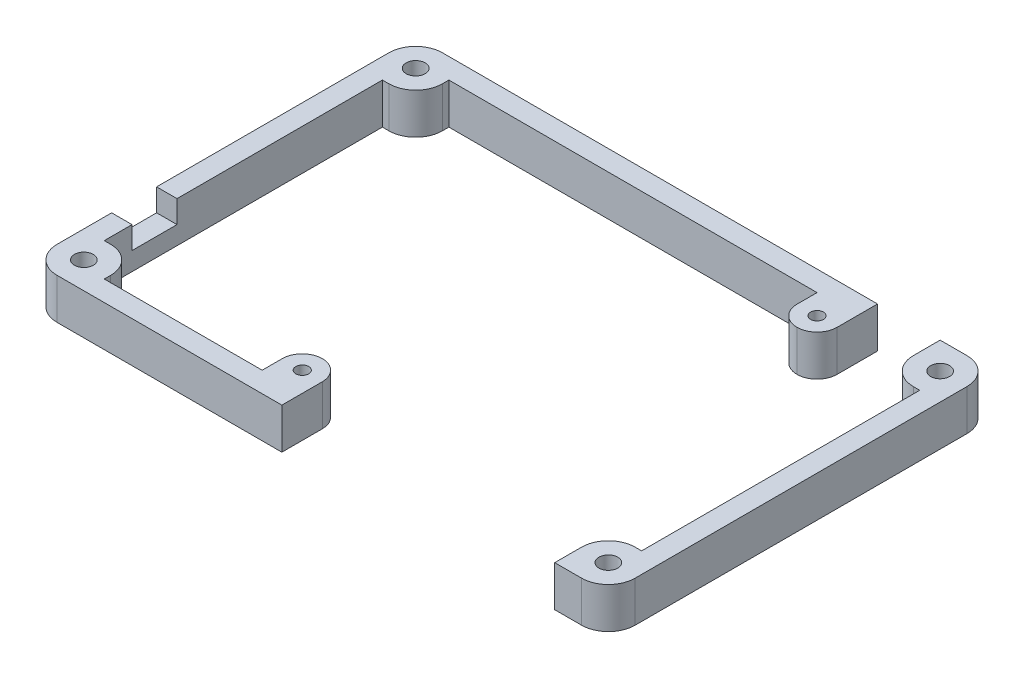
from build123d import *

# Parameters (mm, degrees)
BOSS_EXTRUDE3_DEPTH = 6.35
SKETCH3_W           = 9.747311717
SKETCH3_H           = 6.35
CUT_EXTRUDE1_DEPTH  = 3.175
SKETCH4_W           = 42.475
SKETCH4_H           = 6.35
CUT_EXTRUDE2_DEPTH  = 8.35
SKETCH5_W           = 7
SKETCH5_H           = 7
CUT_EXTRUDE3_DEPTH  = 3.175
SKETCH7_R           = 1.4732
CUT_EXTRUDE4_DEPTH  = 10
SKETCH10_W          = 6.24
SKETCH10_H          = 6.35
BOSS_EXTRUDE4_DEPTH = 6.24
SKETCH11_W          = 6.24
SKETCH11_H          = 6.35
BOSS_EXTRUDE5_DEPTH = 6.24
SKETCH12_R          = 1
CUT_EXTRUDE5_DEPTH  = 55.454774814
SKETCH13_R          = 1
CUT_EXTRUDE6_DEPTH  = 55.454774814
FILLET1_R           = 3.12


with BuildPart() as part:
    # Sketch2 → Boss-Extrude3 (new body)
    with BuildSketch(Plane(origin=(0, 0, 0), x_dir=(1, 0, 0), z_dir=(0, 1, 0))):
        with BuildLine():
            Line((-45, 25.825), (-45, -25.825))
            ThreePointArc((-45, -25.825), (-43.777170811, -28.777170811), (-40.825, -30))
            Line((-40.825, -30), (40.825, -30))
            ThreePointArc((40.825, -30), (43.777170811, -28.777170811), (45, -25.825))
            Line((45, -25.825), (45, 25.825))
            ThreePointArc((45, 25.825), (43.777170811, 28.777170811), (40.825, 30))
            Line((40.825, 30), (-40.825, 30))
            ThreePointArc((-40.825, 30), (-43.777170811, 28.777170811), (-45, 25.825))
        make_face()
        with BuildLine():
            Line((40.825, 21.65), (41.825, 21.65))
            Line((41.825, 21.65), (41.825, -21.65))
            Line((41.825, -21.65), (40.825, -21.65))
            ThreePointArc((40.825, -21.65), (37.872829189, -22.872829189), (36.65, -25.825))
            Line((36.65, -25.825), (36.65, -26.825))
            Line((36.65, -26.825), (-36.65, -26.825))
            Line((-36.65, -26.825), (-36.65, -25.825))
            ThreePointArc((-36.65, -25.825), (-37.872829189, -22.872829189), (-40.825, -21.65))
            Line((-40.825, -21.65), (-41.825, -21.65))
            Line((-41.825, -21.65), (-41.825, 21.65))
            Line((-41.825, 21.65), (-40.825, 21.65))
            ThreePointArc((-40.825, 21.65), (-37.872829189, 22.872829189), (-36.65, 25.825))
            Line((-36.65, 25.825), (-36.65, 26.825))
            Line((-36.65, 26.825), (36.65, 26.825))
            Line((36.65, 26.825), (36.65, 25.825))
            ThreePointArc((36.65, 25.825), (37.872829189, 22.872829189), (40.825, 21.65))
        make_face(mode=Mode.SUBTRACT)
    extrude(amount=BOSS_EXTRUDE3_DEPTH)

    # Sketch3 → Cut-Extrude1 (cut)
    with BuildSketch(Plane(origin=(0, 0, -30), x_dir=(-1, 0, 0), z_dir=(0, 0, -1))):
        with Locations((-31.776344142, 3.175)):
            Rectangle(SKETCH3_W, SKETCH3_H)
    extrude(amount=-CUT_EXTRUDE1_DEPTH, mode=Mode.SUBTRACT)

    # Sketch4 → Cut-Extrude2 (cut)
    with BuildSketch(Plane.XY.offset(30)):
        with Locations((15.4125, 3.175)):
            Rectangle(SKETCH4_W, SKETCH4_H)
    extrude(amount=-CUT_EXTRUDE2_DEPTH, mode=Mode.SUBTRACT)


with BuildPart() as cut_extrude2_piece_1:
    # of the separate pieces the step leaves, piece 1, a body of its own (cut_extrude2_pieces)
    add(part.part.solids().sort_by_distance((-40.825, 0, 30))[0])

    # Sketch5 → Cut-Extrude3 (cut)
    with BuildSketch(Plane.ZY.offset(45)):
        with Locations((13.825, 6.35)):
            Rectangle(SKETCH5_W, SKETCH5_H)
    extrude(amount=-CUT_EXTRUDE3_DEPTH, mode=Mode.SUBTRACT)


with BuildPart() as cut_extrude2_piece_2:
    # of the separate pieces the step leaves, piece 2, a body of its own (cut_extrude2_pieces)
    add(part.part.solids().sort_by_distance((40.825, 0, -30))[0])


with BuildPart() as cut_extrude4_tool:
    # Sketch7 → Cut-Extrude4 (new body)
    with BuildSketch(Plane.XZ):
        with Locations(Location((-40.825, -25.825, 0), (0, 0, 270))):
            Circle(SKETCH7_R)
        with Locations(Location((-40.825, 25.825, 0), (0, 0, 270))):
            Circle(SKETCH7_R)
        with Locations(Location((40.825, 25.825, 0), (0, 0, 270))):
            Circle(SKETCH7_R)
        with Locations(Location((40.825, -25.825, 0), (0, 0, 270))):
            Circle(SKETCH7_R)
    extrude(amount=-CUT_EXTRUDE4_DEPTH)


with BuildPart() as cut_extrude2_piece_1_1:
    add(cut_extrude2_piece_1.part)

    # Cut-Extrude4: cut by cut_extrude4_tool
    add(cut_extrude4_tool.part, mode=Mode.SUBTRACT)

    # Sketch10 → Boss-Extrude4 (add)
    with BuildSketch(Plane(origin=(0, 0, 26.825), x_dir=(-1, 0, 0), z_dir=(0, 0, -1))):
        with Locations((8.945, 3.175)):
            Rectangle(SKETCH10_W, SKETCH10_H)
    extrude(amount=BOSS_EXTRUDE4_DEPTH)

    # Sketch11 → Boss-Extrude5 (add)
    with BuildSketch(Plane.XY.offset(-26.825)):
        with Locations((23.782688283, 3.175)):
            Rectangle(SKETCH11_W, SKETCH11_H)
    extrude(amount=BOSS_EXTRUDE5_DEPTH)

    # Sketch12 → Cut-Extrude5 (cut, through all)
    with BuildSketch(Plane(origin=(0, 6.35, 0), x_dir=(1, 0, 0), z_dir=(0, 1, 0))):
        with Locations(Location((23.782688283, 23.705, 0), (0, 0, 270))):
            Circle(SKETCH12_R)
    extrude(amount=-CUT_EXTRUDE5_DEPTH, mode=Mode.SUBTRACT)

    # Sketch13 → Cut-Extrude6 (cut, through all)
    with BuildSketch(Plane(origin=(0, 6.35, 0), x_dir=(1, 0, 0), z_dir=(0, 1, 0))):
        with Locations(Location((-8.945, -23.705, 0), (0, 0, 270))):
            Circle(SKETCH13_R)
    extrude(amount=-CUT_EXTRUDE6_DEPTH, mode=Mode.SUBTRACT)

    # Fillet1
    fillet1_edges = [cut_extrude2_piece_1_1.edges().sort_by_distance(p)[0] for p in [
        (26.902688283, 3.175, -20.585),
        (20.662688283, 3.175, -20.585),
        (-5.825, 3.175, 20.585),
        (-12.065, 3.175, 20.585),
    ]]
    fillet(fillet1_edges, radius=FILLET1_R - 0.0001)  # a hair under: the kernel refuses the full size


with BuildPart() as cut_extrude2_piece_2_1:
    add(cut_extrude2_piece_2.part)

    # Cut-Extrude4: cut by cut_extrude4_tool
    add(cut_extrude4_tool.part, mode=Mode.SUBTRACT)


solid = Compound([cut_extrude2_piece_1_1.part, cut_extrude2_piece_2_1.part])
